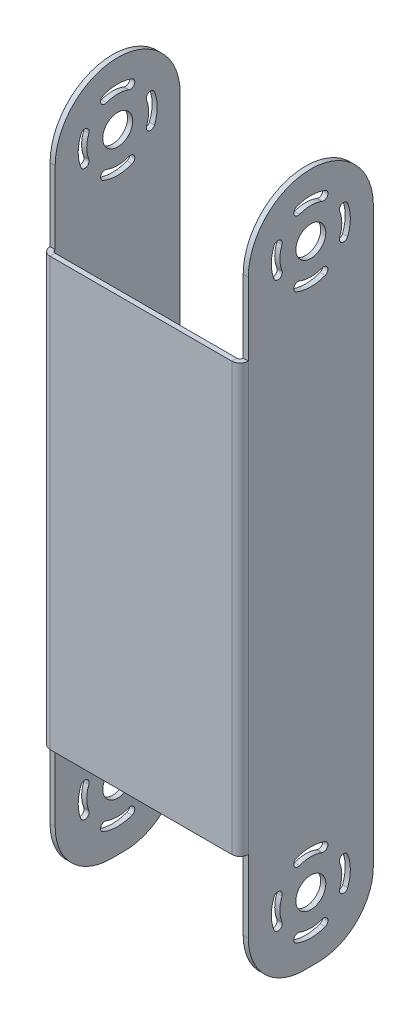
from build123d import *

# Parameters (mm, degrees)
SKETCH_1_W                         = 44
SKETCH_1_H                         = 100
SM_BASE_FLANGE_1_DEPTH             = 1.2
SM_EDGE_FLANGE_2_STRIP_W           = 6.2732
SM_EDGE_FLANGE_2_STRIP_H           = 1.2
SM_EDGE_FLANGE_2_STRIP_CUT_DEPTH   = 100
SM_EDGE_FLANGE_2_STRIP_2_W         = 6.2732
SM_EDGE_FLANGE_2_STRIP_2_H         = 1.2
SM_EDGE_FLANGE_2_STRIP_CUT_2_DEPTH = 100
SM_EDGE_FLANGE_2_DEPTH             = 100
SM_EDGE_FLANGE_2_BEND_DEPTH        = 100
EXTRUDE_1_DEPTH                    = 1.2
EXTRUDE_START                      = -1.2
EXTRUDE_2_DEPTH                    = 1.2
SKETCH_44_R                        = 3.5
CUT_EXTRUDE_3_DEPTH                = 94.590588423
SKETCH_45_W                        = 1.2
SKETCH_45_H                        = 29.2634
EXTRUDE_3_DEPTH                    = 30
SKETCH_48_R                        = 3.5
CUT_EXTRUDE_4_DEPTH                = 104.065268641
FILLET_1_R                         = 13


# Sheet-metal steps are written as plain solids
with BuildPart() as part:
    # Sketch 1 → 基材-凸緣1 (new body)
    with BuildSketch(Plane.XY):
        with Locations((-29.036181479, -6.57972973)):
            Rectangle(SKETCH_1_W, SKETCH_1_H)
    extrude(amount=-SM_BASE_FLANGE_1_DEPTH)

    # 邊線-凸緣2 strip (across the edge) → 邊線-凸緣2 strip cut (cut)
    with BuildSketch(Plane(origin=(-7.036181479, 43.42027027, -1.2), x_dir=(-1, 0, 0), z_dir=(0, -1, 0))):
        with Locations((-2.4, -0.6)):
            Rectangle(SM_EDGE_FLANGE_2_STRIP_W, SM_EDGE_FLANGE_2_STRIP_H)
    extrude(amount=SM_EDGE_FLANGE_2_STRIP_CUT_DEPTH, mode=Mode.SUBTRACT)

    # 邊線-凸緣2 strip 2 (across the edge) → 邊線-凸緣2 strip cut 2 (cut)
    with BuildSketch(Plane(origin=(-51.036181479, -56.57972973, -1.2), x_dir=(1, 0, 0), z_dir=(0, 1, 0))):
        with Locations((-2.4, -0.6)):
            Rectangle(SM_EDGE_FLANGE_2_STRIP_2_W, SM_EDGE_FLANGE_2_STRIP_2_H)
    extrude(amount=SM_EDGE_FLANGE_2_STRIP_CUT_2_DEPTH, mode=Mode.SUBTRACT)

    # 邊線-凸緣2 section (across the edge) → 邊線-凸緣2 (add)
    with BuildSketch(Plane(origin=(-7.036181479, 43.42027027, -1.2), x_dir=(-1, 0, 0), z_dir=(0, -1, 0))):
        with BuildLine():
            Line((-1.2, 0.7366), (-1.2, 30))
            Line((-1.2, 30), (0, 30))
            Line((0, 30), (0, 0.7366))
            ThreePointArc((0, 0.7366), (0.215745145, 0.215745145), (0.7366, 0))
            Line((0.7366, 0), (0.7366, -1.2))
            ThreePointArc((0.7366, -1.2), (-0.632782992, -0.632782992), (-1.2, 0.7366))
        make_face()
    extrude(amount=SM_EDGE_FLANGE_2_DEPTH)

    # 邊線-凸緣2 section 2 (across the edge) → 邊線-凸緣2 bend (add)
    with BuildSketch(Plane(origin=(-51.036181479, -56.57972973, -1.2), x_dir=(1, 0, 0), z_dir=(0, 1, 0))):
        with BuildLine():
            Line((-1.2, 0.7366), (-1.2, 30))
            Line((-1.2, 30), (0, 30))
            Line((0, 30), (0, 0.7366))
            ThreePointArc((0, 0.7366), (0.215745145, 0.215745145), (0.7366, 0))
            Line((0.7366, 0), (0.7366, -1.2))
            ThreePointArc((0.7366, -1.2), (-0.632782992, -0.632782992), (-1.2, 0.7366))
        make_face()
    extrude(amount=SM_EDGE_FLANGE_2_BEND_DEPTH)

    # 草圖38 → 填料-伸長1 (add)
    with BuildSketch(Plane(origin=(-5.836181479, 0, 0), x_dir=(0, 0, -1), z_dir=(1, 0, 0))):
        with BuildLine():
            Line((1.9366, 43.42027027), (31.2, 43.42027027))
            Line((31.2, 43.42027027), (31.2, 60.42027027))
            ThreePointArc((31.2, 60.42027027), (16.5683, 75.05197027), (1.9366, 60.42027027))
            Line((1.9366, 60.42027027), (1.9366, 43.42027027))
        make_face()
    extrude(amount=-EXTRUDE_1_DEPTH)

    # 草圖41 → 填料-伸長2 (add)
    with BuildSketch(Plane.ZY.offset(52.236181479).offset(EXTRUDE_START)):
        with BuildLine():
            Line((-1.9366, 43.42027027), (-31.2, 43.42027027))
            Line((-31.2, 43.42027027), (-31.2, 60.42027027))
            ThreePointArc((-31.2, 60.42027027), (-16.5683, 75.05197027), (-1.9366, 60.42027027))
            Line((-1.9366, 60.42027027), (-1.9366, 43.42027027))
        make_face()
    extrude(amount=EXTRUDE_2_DEPTH)

    # 草圖44 → 除料-伸長3 (cut, through all)
    with BuildSketch(Plane.ZY.offset(52.236181479)):
        with Locations((-16.5683, 60.42027027)):
            Circle(SKETCH_44_R)
        with BuildLine():
            ThreePointArc((-13.204663636, 69.037024323), (-16.5683, 69.67027027), (-19.931936364, 69.037024323))
            ThreePointArc((-19.931936364, 69.037024323), (-20.499840979, 67.741846981), (-19.204663636, 67.173942366))
            ThreePointArc((-19.204663636, 67.173942366), (-16.5683, 67.67027027), (-13.931936364, 67.173942366))
            ThreePointArc((-13.931936364, 67.173942366), (-12.636759021, 67.741846981), (-13.204663636, 69.037024323))
        make_face()
        with BuildLine():
            ThreePointArc((-7.951545947, 57.056633907), (-7.3183, 60.42027027), (-7.951545947, 63.783906634))
            ThreePointArc((-7.951545947, 63.783906634), (-9.246723289, 64.351811249), (-9.814627904, 63.056633907))
            ThreePointArc((-9.814627904, 63.056633907), (-9.3183, 60.42027027), (-9.814627904, 57.783906634))
            ThreePointArc((-9.814627904, 57.783906634), (-9.246723289, 56.488729292), (-7.951545947, 57.056633907))
        make_face()
        with BuildLine():
            ThreePointArc((-19.931936364, 51.803516217), (-16.5683, 51.17027027), (-13.204663636, 51.803516217))
            ThreePointArc((-13.204663636, 51.803516217), (-12.636759021, 53.098693559), (-13.931936364, 53.666598175))
            ThreePointArc((-13.931936364, 53.666598175), (-16.5683, 53.17027027), (-19.204663636, 53.666598175))
            ThreePointArc((-19.204663636, 53.666598175), (-20.499840979, 53.098693559), (-19.931936364, 51.803516217))
        make_face()
        with BuildLine():
            ThreePointArc((-25.185054053, 63.783906634), (-25.8183, 60.42027027), (-25.185054053, 57.056633907))
            ThreePointArc((-25.185054053, 57.056633907), (-23.889876711, 56.488729292), (-23.321972096, 57.783906634))
            ThreePointArc((-23.321972096, 57.783906634), (-23.8183, 60.42027027), (-23.321972096, 63.056633907))
            ThreePointArc((-23.321972096, 63.056633907), (-23.889876711, 64.351811249), (-25.185054053, 63.783906634))
        make_face()
    extrude(amount=-CUT_EXTRUDE_3_DEPTH, mode=Mode.SUBTRACT)

    # 草圖45 → 填料-伸長3 (add)
    with BuildSketch(Plane.XZ.offset(56.57972973)):
        with Locations((-51.636181479, -16.5683)):
            Rectangle(SKETCH_45_W, SKETCH_45_H)
        with Locations((-6.436181479, -16.5683)):
            Rectangle(SKETCH_45_W, SKETCH_45_H)
    extrude(amount=EXTRUDE_3_DEPTH)

    # 草圖48 → 除料-伸長4 (cut, through all)
    with BuildSketch(Plane.ZY.offset(52.236181479)):
        with Locations((-16.5683, -71.57972973)):
            Circle(SKETCH_48_R)
        with BuildLine():
            ThreePointArc((-7.951545947, -74.943366093), (-7.3183, -71.57972973), (-7.951545947, -68.216093366))
            ThreePointArc((-7.951545947, -68.216093366), (-9.246723289, -67.648188751), (-9.814627904, -68.943366093))
            ThreePointArc((-9.814627904, -68.943366093), (-9.3183, -71.57972973), (-9.814627904, -74.216093366))
            ThreePointArc((-9.814627904, -74.216093366), (-9.246723289, -75.511270708), (-7.951545947, -74.943366093))
        make_face()
        with BuildLine():
            ThreePointArc((-19.204663636, -78.333401825), (-16.5683, -78.82972973), (-13.931936364, -78.333401825))
            ThreePointArc((-13.931936364, -78.333401825), (-12.636759021, -78.901306441), (-13.204663636, -80.196483783))
            ThreePointArc((-13.204663636, -80.196483783), (-16.5683, -80.82972973), (-19.931936364, -80.196483783))
            ThreePointArc((-19.931936364, -80.196483783), (-20.499840979, -78.901306441), (-19.204663636, -78.333401825))
        make_face()
        with BuildLine():
            ThreePointArc((-23.321972096, -68.943366093), (-23.8183, -71.57972973), (-23.321972096, -74.216093366))
            ThreePointArc((-23.321972096, -74.216093366), (-23.889876711, -75.511270708), (-25.185054053, -74.943366093))
            ThreePointArc((-25.185054053, -74.943366093), (-25.8183, -71.57972973), (-25.185054053, -68.216093366))
            ThreePointArc((-25.185054053, -68.216093366), (-23.889876711, -67.648188751), (-23.321972096, -68.943366093))
        make_face()
        with BuildLine():
            ThreePointArc((-13.931936364, -64.826057634), (-16.5683, -64.32972973), (-19.204663636, -64.826057634))
            ThreePointArc((-19.204663636, -64.826057634), (-20.499840979, -64.258153019), (-19.931936364, -62.962975677))
            ThreePointArc((-19.931936364, -62.962975677), (-16.5683, -62.32972973), (-13.204663636, -62.962975677))
            ThreePointArc((-13.204663636, -62.962975677), (-12.636759021, -64.258153019), (-13.931936364, -64.826057634))
        make_face()
    extrude(amount=-CUT_EXTRUDE_4_DEPTH, mode=Mode.SUBTRACT)

    # 圓角1
    fillet_1_edges = [part.edges().sort_by_distance(p)[0] for p in [
        (-51.636181479, -86.57972973, -31.2),
        (-51.636181479, -86.57972973, -1.9366),
        (-6.436181479, -86.57972973, -31.2),
        (-6.436181479, -86.57972973, -1.9366),
    ]]
    fillet(fillet_1_edges, radius=FILLET_1_R)


solid = part.part
